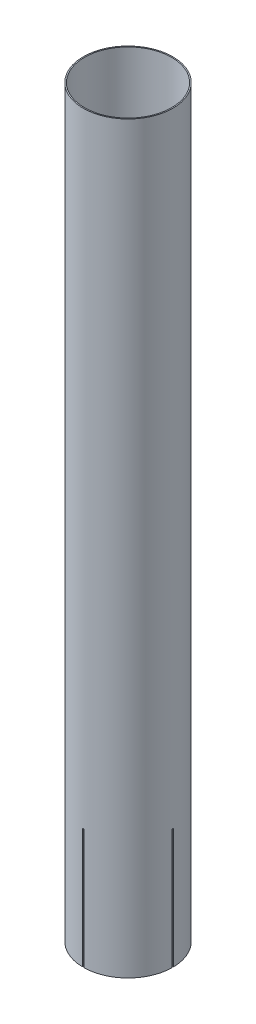
from build123d import *

# Parameters (mm, degrees)
SKETCH1_W          = 2
SKETCH1_H          = 1300
CUT_EXTRUDE1_DEPTH = 1.5
CIRPATTERN1_COUNT  = 4


with BuildPart() as part:
    # Sketch1 → Revolve1 (revolve)
    with BuildSketch(Plane.XY):
        with Locations((77.2, 650)):
            Rectangle(SKETCH1_W, SKETCH1_H)
    revolve(axis=Axis((0, 0, 0), (0, 1, 0)))

    # Sketch2 → Cut-Extrude1 (cut, symmetric)
    with BuildSketch(Plane.XY):
        Polygon((-185.2, 150), (-185.2, 0), (-78.2, 0), (0, 0), (0, 210), (-78.2, 210), align=None)
    cut_extrude1 = extrude(amount=CUT_EXTRUDE1_DEPTH, both=True, mode=Mode.SUBTRACT)

    # CirPattern1: Cut-Extrude1 ×4 about axis
    cirpattern1_axis = Axis((0, 0, 0), (0, -1, 0))
    for i in range(1, CIRPATTERN1_COUNT):
        add(cut_extrude1.rotate(cirpattern1_axis, i * 360 / CIRPATTERN1_COUNT), mode=Mode.SUBTRACT)


solid = part.part
